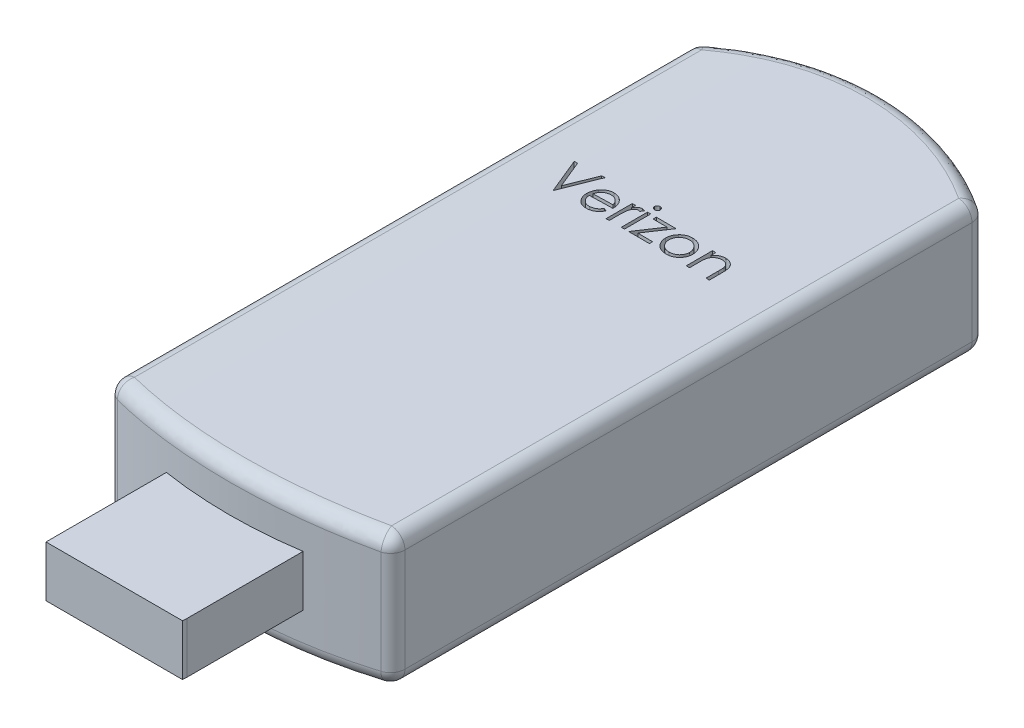
from build123d import *

# Parameters (mm, degrees)
BOSS_EXTRUDE1_DEPTH      = 6.0325
SKETCH7_W                = 0.2849358974358973
SKETCH7_H                = 2.3201923076923068
CUT_EXTRUDE3_DEPTH       = 1.5239999999999987
CUT_EXTRUDE1_DEPTH       = 60.16156349913395
CUT_EXTRUDE2_DEPTH       = 34.601982625255914
BOSS_EXTRUDE2_REACH      = 39.546
BOSS_EXTRUDE2_END_RADIUS = 49.760028750000046
BOSS_EXTRUDE3_DEPTH      = 4.4958
FILLET1_R                = 1.27


with BuildPart() as part:
    # Sketch1 → Boss-Extrude1 (new, symmetric)
    with BuildSketch(Plane(origin=(0, 0, 0), x_dir=(1, 0, 0), z_dir=(0, 1, 0))):
        Polygon((-12.522200000000005, 28.75279999999999), (12.522199999999993, 28.75279999999999), (12.522200000000002, -28.752799999999997), (-12.5222, -28.752799999999997), align=None)
    extrude(amount=BOSS_EXTRUDE1_DEPTH, both=True)

    # Sketch7 → Cut-Extrude3 (cut)
    # profile 1 of 8: a face of its own
    with BuildSketch(Plane(origin=(0, 6.0325, 0), x_dir=(1, 0, 0), z_dir=(0, 1, 0))):
        Polygon((-8.24346165754675, 9.907809330896033), (-7.9381731960082895, 9.907809330896033), (-6.879839862674955, 7.405715981537058), (-5.8215065293416215, 9.907809330896033), (-5.516218067803161, 9.907809330896033), (-6.859487298572391, 6.732809330896032), (-6.900192426777519, 6.732809330896032), align=None)
    # profile 2 of 8: a face of its own
    with BuildSketch(Plane(origin=(0, 6.0325, 0), x_dir=(1, 0, 0), z_dir=(0, 1, 0))):
        with BuildLine():
            Line((-3.123519750495468, 7.465501638588339), (-2.8703847344698272, 7.332573954293468))
            add(Edge.make_bspline(
                [(-2.8703847344698272, 7.332573954293468), (-2.890556503008947, 7.296793218065141), (-2.9298027764200434, 7.2271780747947885), (-2.9972948834352406, 7.13153631565227), (-3.068044834988314, 7.04549588771282), (-3.145246291677269, 6.9713554156124315), (-3.2265895004426985, 6.906720230671554), (-3.3125255515697076, 6.850170918247935), (-3.403501836229628, 6.801984831934233), (-3.4995226579927623, 6.76138789593536), (-3.6013943936711206, 6.7301735691374605), (-3.7093639121288033, 6.708126168730543), (-3.8236380543652744, 6.694497917883364), (-3.901966374673883, 6.692914825892747), (-3.942074437995468, 6.692104202690904)],
                knots=[0, 0, 0, 0, 1.120438280834344, 2.1799291928520534, 3.1904907245114247, 4.156257408411693, 5.0951983406147265, 6.022838206048523, 6.959905091848168, 7.9013211663531715, 8.86406683785401, 9.862729781234922, 10.90560950455938, 11.999999999999998, 11.999999999999998, 11.999999999999998, 11.999999999999998], degree=3))
            add(Edge.make_bspline(
                [(-3.942074437995468, 6.692104202690904), (-3.9866532319026193, 6.6931448545970165), (-4.073613544263185, 6.695174864987218), (-4.200196029144133, 6.712675886295626), (-4.31937593011903, 6.741225811682033), (-4.431146546732656, 6.7811088386062615), (-4.53523416157086, 6.8332036254595865), (-4.631845651293105, 6.8966668696672535), (-4.721489078331388, 6.971172557849007), (-4.801339610949346, 7.057366045869324), (-4.873225133122389, 7.149606107130151), (-4.936657841243187, 7.245723230913863), (-4.989687082266609, 7.345475584543774), (-5.032824092944165, 7.448228131354707), (-5.067662791881055, 7.5533332347831195), (-5.091944016014479, 7.661747208935196), (-5.105941001683914, 7.773176631781641), (-5.108085891564231, 7.848557786325602), (-5.109166785751879, 7.886545308460134)],
                knots=[0, 0, 0, 0, 1.1452585230262686, 2.2340675950855617, 3.2767471583466503, 4.290159414346911, 5.277019951787686, 6.260822364392955, 7.254936241552866, 8.264827045116265, 9.274100331278769, 10.257902743884044, 11.22070474718039, 12.172965370818138, 13.118907548450304, 14.06271320799012, 15.023725156007151, 16, 16, 16, 16], degree=3))
            add(Edge.make_bspline(
                [(-5.109166785751879, 7.886545308460134), (-5.108205993259124, 7.9221913331960785), (-5.106301829418917, 7.992837046876308), (-5.094299615140359, 8.09739936227164), (-5.073028663571517, 8.199025172779688), (-5.043840141131943, 8.297798922008594), (-5.0061472249514365, 8.393555229265585), (-4.96003514037672, 8.486352372695166), (-4.9054320548111825, 8.576091606711438), (-4.863274700760673, 8.632700163717816), (-4.842039381905725, 8.661214779613982)],
                knots=[0, 0, 0, 0, 1.0243584636889644, 2.0301432001959165, 3.0194274126504173, 4.004406731860269, 4.98636706593981, 5.97262665546806, 6.978780324837733, 8, 8, 8, 8], degree=3))
            add(Edge.make_bspline(
                [(-4.842039381905725, 8.661214779613982), (-4.813275983959076, 8.695567254622429), (-4.756660339535861, 8.763184005388212), (-4.660905645750574, 8.852028058061547), (-4.557219039068555, 8.92645348268645), (-4.446899921106268, 8.988145670468977), (-4.328666119637017, 9.035021050241001), (-4.204106977052922, 9.069952928408846), (-4.071804195261634, 9.089527266989036), (-3.9813573163584137, 9.092292087488984), (-3.935078244085212, 9.093706766793469)],
                knots=[0, 0, 0, 0, 1.0306820359004325, 2.0287146798918063, 2.9971460585133616, 3.9627203379023315, 4.930598197086325, 5.918074683524115, 6.934738563044366, 8, 8, 8, 8], degree=3))
            add(Edge.make_bspline(
                [(-3.935078244085212, 9.093706766793469), (-3.887500773559726, 9.092478451012413), (-3.79416462188679, 9.090068775450078), (-3.6580640549462773, 9.067729173000433), (-3.52928540494159, 9.032302927075065), (-3.407880204604309, 8.98227055997815), (-3.2938361452070968, 8.917718680854026), (-3.187894514521483, 8.837761438939165), (-3.088243499566542, 8.744853602670709), (-3.030269288750617, 8.673404119833098), (-3.000768348251878, 8.637046109742187)],
                knots=[0, 0, 0, 0, 1.0563218754078567, 2.0722627262349573, 3.0550385914001366, 4.018067549719884, 4.982017516219839, 5.957941054872016, 6.960871418734544, 8, 8, 8, 8], degree=3))
            add(Edge.make_bspline(
                [(-3.000768348251878, 8.637046109742187), (-2.980696054211262, 8.60964714662748), (-2.940685073330878, 8.555031596102632), (-2.8905680611561513, 8.465976332161299), (-2.847063852849531, 8.37280315014366), (-2.812290381071848, 8.27400595207188), (-2.7841331192721213, 8.170755332915006), (-2.7637615765578114, 8.062313167352741), (-2.7518148511300016, 7.948711747761108), (-2.7494665328210632, 7.871308372435812), (-2.7482693498544424, 7.831847792434494)],
                knots=[0, 0, 0, 0, 0.9481747201060822, 1.8900381052939734, 2.849395471927453, 3.817997239188475, 4.8123189665736215, 5.836947057344353, 6.897266129131515, 8, 8, 8, 8], degree=3))
            Line((-2.7482693498544424, 7.831847792434494), (-4.82423088831598, 7.831847792434494))
            add(Edge.make_bspline(
                [(-4.82423088831598, 7.831847792434494), (-4.822834245340964, 7.801276657010326), (-4.820087803259382, 7.741159752180239), (-4.807283351958402, 7.653193398955425), (-4.787100535748918, 7.569397581421276), (-4.758735028926854, 7.490400821916773), (-4.724384390731345, 7.415171349099332), (-4.682305919075531, 7.344267215563506), (-4.632105037990049, 7.278011379018241), (-4.5761110106913705, 7.2158111899159), (-4.51378385992264, 7.160420356570916), (-4.448213082086273, 7.110843388129824), (-4.37845963384608, 7.069291168239615), (-4.305073515247992, 7.035563696820416), (-4.228173395867205, 7.00916011010966), (-4.147735047440783, 6.99113715849015), (-4.063916756176118, 6.97906571153938), (-4.006779697446386, 6.977723443821758), (-3.9776914251749553, 6.977040100126802)],
                knots=[0, 0, 0, 0, 1.0941538416602907, 2.1516094006952207, 3.174256924543306, 4.1720556391757855, 5.149267564922385, 6.12859581567239, 7.114449969702824, 8.118368179264088, 9.11720380756841, 10.09244225010101, 11.054858984379472, 12.01512212306778, 12.976791627669245, 13.957293640751892, 14.960065497430492, 16, 16, 16, 16], degree=3))
            add(Edge.make_bspline(
                [(-3.9776914251749553, 6.977040100126802), (-3.9492514555627385, 6.977591694382566), (-3.892821100221321, 6.978686163198166), (-3.8087826082029483, 6.989328682381723), (-3.7261060369190964, 7.0065374324094165), (-3.6451335735266883, 7.030023351985313), (-3.567508591873681, 7.058668067824989), (-3.4956215571752796, 7.093232802978081), (-3.429508790143008, 7.131468644666313), (-3.3677169704540075, 7.175201707031667), (-3.3077811407703788, 7.228730562384395), (-3.2483247423798653, 7.295528680709747), (-3.184573778257467, 7.374529509484871), (-3.144668933411339, 7.433988792193412), (-3.123519750495468, 7.465501638588339)],
                knots=[0, 0, 0, 0, 0.9911071599772423, 1.966546729181966, 2.9479048755540354, 3.9327083442494657, 4.903319530923831, 5.828989031447169, 6.710028674367333, 7.563221710290545, 8.463672341184845, 9.504779593159295, 10.677557248921072, 12, 12, 12, 12], degree=3))
        make_face()
        with BuildLine():
            add(Edge.make_bspline(
                [(-3.03320524729034, 8.11678368987039), (-3.043634328135338, 8.154577868177629), (-3.0637069516249276, 8.227319495415417), (-3.1056499393727544, 8.328049446032454), (-3.1528862655757086, 8.41757347051975), (-3.20878597903714, 8.495206423363483), (-3.2721215372841677, 8.564152467282991), (-3.345278238686212, 8.624403612399465), (-3.427316513497828, 8.678303728724934), (-3.517812305398415, 8.723799210384145), (-3.613644496145856, 8.762525010796585), (-3.7139801131485837, 8.788492080083746), (-3.816358249288531, 8.806280736312713), (-3.885604351903945, 8.807937277532137), (-3.920449838636494, 8.80877086935757)],
                knots=[0, 0, 0, 0, 1.1548815021618077, 2.222775133544412, 3.2100062769292697, 4.132804581333333, 5.035138422668762, 5.962687519113333, 6.9196550260621965, 7.923214229035662, 8.94463938105154, 9.960483928637434, 10.973690539665625, 12, 12, 12, 12], degree=3))
            add(Edge.make_bspline(
                [(-3.920449838636494, 8.80877086935757), (-3.9488882578622353, 8.808215995884527), (-4.005105033788093, 8.807119127684725), (-4.087928145649054, 8.796714081790062), (-4.167466158239107, 8.779514793942), (-4.244305954857962, 8.75596086902435), (-4.317440599738414, 8.724565922468274), (-4.388374425193955, 8.687751138329663), (-4.455303784644605, 8.642809844451712), (-4.497160531255919, 8.6085571689968), (-4.518306409149315, 8.591252840511416)],
                knots=[0, 0, 0, 0, 1.0487358100554192, 2.073130210625136, 3.073294107867221, 4.047935619982199, 5.032784715118843, 6.00535298738967, 6.992311500921003, 7.999999999999999, 7.999999999999999, 7.999999999999999, 7.999999999999999], degree=3))
            add(Edge.make_bspline(
                [(-4.518306409149315, 8.591252840511416), (-4.533449600645563, 8.577560139909231), (-4.564095729551886, 8.549849451060439), (-4.605044631188604, 8.502107242260577), (-4.64425177426822, 8.450625468013591), (-4.679933016408123, 8.393434533556706), (-4.712660541268031, 8.331185684029293), (-4.743285663425043, 8.264403972066287), (-4.770850480099081, 8.192582632471833), (-4.786359094200877, 8.142533348314746), (-4.79433805979034, 8.11678368987039)],
                knots=[0, 0, 0, 0, 0.8798707608949656, 1.780643978911088, 2.7079989676995635, 3.6696685238210653, 4.684282771663967, 5.740141943567125, 6.837334558008167, 8, 8, 8, 8], degree=3))
            Line((-4.79433805979034, 8.11678368987039), (-3.03320524729034, 8.11678368987039))
        make_face(mode=Mode.SUBTRACT)
    # profile 3 of 8: a face of its own
    with BuildSketch(Plane(origin=(0, 6.0325, 0), x_dir=(1, 0, 0), z_dir=(0, 1, 0))):
        with BuildLine():
            Line((-2.2598078113929043, 9.05300163858834), (-1.9748719139570068, 9.05300163858834))
            Line((-1.9748719139570068, 9.05300163858834), (-1.9748719139570068, 8.711460172242187))
            add(Edge.make_bspline(
                [(-1.9748719139570068, 8.711460172242187), (-1.9538363970897543, 8.743260816509245), (-1.9136061345240443, 8.80407930158361), (-1.8467379771817112, 8.88451502462621), (-1.778245669522016, 8.951112959766563), (-1.7078013210404221, 9.004184008936393), (-1.6348869018362158, 9.043928766726587), (-1.5611026670634685, 9.073041734219485), (-1.4852877765499093, 9.090256870184776), (-1.4343408881431867, 9.092555260810324), (-1.4088162248544427, 9.093706766793469)],
                knots=[0, 0, 0, 0, 1.2804752998839455, 2.448899061921011, 3.506932113041637, 4.48433164204174, 5.4025377996216175, 6.2889090754254156, 7.142734304840704, 8, 8, 8, 8], degree=3))
            add(Edge.make_bspline(
                [(-1.4088162248544427, 9.093706766793469), (-1.3890166286843737, 9.092626789096649), (-1.3482776728192636, 9.09040466479936), (-1.2866077520682693, 9.074791988159964), (-1.2230683349788418, 9.049865496272604), (-1.1821177408301322, 9.026424722855076), (-1.1607693498544422, 9.014204563267826)],
                knots=[0, 0, 0, 0, 0.9011101914680424, 1.8540927807059169, 2.88129422130767, 4, 4, 4, 4], degree=3))
            Line((-1.1607693498544422, 9.014204563267826), (-1.317229686392904, 8.767429723524238))
            add(Edge.make_bspline(
                [(-1.317229686392904, 8.767429723524238), (-1.3309357270019824, 8.773544107785831), (-1.3569524158935595, 8.78515037962134), (-1.3950112010087838, 8.798886345955403), (-1.4301006993289325, 8.806974355331912), (-1.4524559272723954, 8.808199649020613), (-1.4628777232518781, 8.80877086935757)],
                knots=[0, 0, 0, 0, 1.1805552054775093, 2.2409197795529536, 3.1799334269636095, 4, 4, 4, 4], degree=3))
            add(Edge.make_bspline(
                [(-1.4628777232518781, 8.80877086935757), (-1.4857429243654445, 8.80724683545894), (-1.5323813066906078, 8.804138248078152), (-1.6008565311551608, 8.779700901032388), (-1.6673022104313733, 8.740217290358308), (-1.7200722184076118, 8.69642849603645), (-1.7609319763726308, 8.654202994050904), (-1.7900877523898266, 8.617329086007992), (-1.8168328156978055, 8.575982755978627), (-1.8423872299182575, 8.530870828528457), (-1.8656702253794115, 8.481223039627773), (-1.8874005324427985, 8.427535410309337), (-1.907048215236669, 8.36974575778246), (-1.9182516510686594, 8.329484471582647), (-1.9239905037005964, 8.30886101358834)],
                knots=[0, 0, 0, 0, 1.1256783522279976, 2.2960575376360737, 3.5422873995020447, 4.923748040679578, 5.663163012615323, 6.437101912157194, 7.237424739643565, 8.089412069887159, 8.991984278710643, 9.939400610058751, 10.944477711153127, 12, 12, 12, 12], degree=3))
            add(Edge.make_bspline(
                [(-1.9239905037005964, 8.30886101358834), (-1.9282834605389187, 8.290466720413265), (-1.9377920337193397, 8.249724758789991), (-1.9470372144774837, 8.181372882792386), (-1.9561717057847783, 8.1006157066279), (-1.9626093524315216, 8.00722844022639), (-1.9685765763612713, 7.901444294662987), (-1.9719421509530344, 7.783102115418716), (-1.9747571427438018, 7.652080432597), (-1.974832496262405, 7.560482269307773), (-1.9748719139570068, 7.5125669430755195)],
                knots=[0, 0, 0, 0, 0.5668389480122498, 1.2555051964588233, 2.0688031596806793, 3.007127436713625, 4.06532934159123, 5.249902468625793, 6.56141416318328, 8, 8, 8, 8], degree=3))
            Line((-1.9748719139570068, 7.5125669430755195), (-1.9748719139570068, 6.732809330896032))
            Line((-1.9748719139570068, 6.732809330896032), (-2.2598078113929043, 6.732809330896032))
            Line((-2.2598078113929043, 6.732809330896032), (-2.2598078113929043, 9.05300163858834))
        make_face()
    # profile 4 of 8: a face of its own
    with BuildSketch(Plane(origin=(0, 6.0325, 0), x_dir=(1, 0, 0), z_dir=(0, 1, 0))):
        with BuildLine():
            add(Edge.make_bspline(
                [(-0.7753426671621346, 10.029924715511417), (-0.7576612592686096, 10.029104520123857), (-0.7230376666972204, 10.027498420027147), (-0.6729694881623146, 10.013744794391544), (-0.6273791986368373, 9.990431508309747), (-0.5869408266581755, 9.959153512064216), (-0.5522409008832999, 9.92236937406905), (-0.5279469707570341, 9.879496924258364), (-0.5123328685667512, 9.83317944478561), (-0.5104473219935423, 9.800871471028486), (-0.5094872985723902, 9.784421911024237)],
                knots=[0, 0, 0, 0, 1.0551941146486337, 2.0662727385357784, 3.0747289982328403, 4.095836921005721, 5.109056067369165, 6.073838105316671, 7.01929734428161, 8, 8, 8, 8], degree=3))
            add(Edge.make_bspline(
                [(-0.5094872985723902, 9.784421911024237), (-0.5104689721277872, 9.76839936136904), (-0.5124096245705223, 9.736724676891438), (-0.527934910341394, 9.691210170101035), (-0.5524479403842485, 9.648933427226838), (-0.5869185757736637, 9.61222071153429), (-0.627385094682527, 9.580960006257184), (-0.6729679218465431, 9.557642135964766), (-0.7230380787132991, 9.54388972564015), (-0.7576613985483014, 9.542283457998481), (-0.7753426671621346, 9.541463177049879)],
                knots=[0, 0, 0, 0, 0.9612970799407157, 1.900370562215021, 2.8599764074188605, 3.87933697972215, 4.906634144680994, 5.921202961029529, 6.938410036506095, 8, 8, 8, 8], degree=3))
            add(Edge.make_bspline(
                [(-0.7753426671621346, 9.541463177049879), (-0.7928217453490983, 9.54225213753669), (-0.8268424873528449, 9.543787746044528), (-0.8761609800490207, 9.557911976419623), (-0.9213625382843866, 9.580967985589366), (-0.9618797770530062, 9.612016024925738), (-0.9956528808228672, 9.649158895984083), (-1.0202349331468972, 9.691184369697329), (-1.0357243628574238, 9.736731245672214), (-1.037669847386458, 9.76840156796693), (-1.0386539652390576, 9.784421911024237)],
                knots=[0, 0, 0, 0, 1.0549340136186576, 2.053291227626915, 3.073705703540028, 4.106921865220684, 5.12354521460313, 6.088680038223072, 7.0331641972253, 8, 8, 8, 8], degree=3))
            add(Edge.make_bspline(
                [(-1.0386539652390576, 9.784421911024237), (-1.0376914080937774, 9.80086918173528), (-1.0358008851265117, 9.833172659176105), (-1.0202233226294888, 9.879523153321045), (-0.9958576398740643, 9.922142087099623), (-0.9618574143829588, 9.959358075864595), (-0.9213684897090887, 9.990423577405123), (-0.876159442308012, 10.013474967767808), (-0.8268428935860049, 10.027600397053696), (-0.7928218832249421, 10.029135840057029), (-0.7753426671621346, 10.029924715511417)],
                knots=[0, 0, 0, 0, 0.9863189498223914, 1.9371926506717805, 2.907499808429839, 3.917963146730997, 4.944918756744033, 5.959150250057987, 6.951458132713477, 8, 8, 8, 8], degree=3))
        make_face()
    # profile 5 of 8: a face of its own
    with BuildSketch(Plane(origin=(0, 6.0325, 0), x_dir=(1, 0, 0), z_dir=(0, 1, 0))):
        with Locations((-0.7740706319057243, 7.892905484742187)):
            Rectangle(SKETCH7_W, SKETCH7_H)
    # profile 6 of 8: a face of its own
    with BuildSketch(Plane(origin=(0, 6.0325, 0), x_dir=(1, 0, 0), z_dir=(0, 1, 0))):
        Polygon((-0.14314114472623735, 9.05300163858834), (1.6071793680942759, 9.05300163858834), (0.2575499610429927, 7.017745228331929), (1.5664742398891467, 7.017745228331929), (1.5664742398891467, 6.732809330896032), (-0.26525652934162103, 6.732809330896032), (1.0850088953378647, 8.768065741152444), (-0.14314114472623735, 8.768065741152444), align=None)
    # profile 7 of 8: a face of its own
    with BuildSketch(Plane(origin=(0, 6.0325, 0), x_dir=(1, 0, 0), z_dir=(0, 1, 0))):
        with BuildLine():
            add(Edge.make_bspline(
                [(3.0534834546327367, 9.093706766793469), (3.0970183949976913, 9.092779765546092), (3.182379773650226, 9.090962142647673), (3.3073912129836254, 9.07153570951994), (3.4267214434401363, 9.04182917182727), (3.540827489188474, 9.000761397659728), (3.6482479857777537, 8.94571419966383), (3.7505476143614067, 8.88002862842862), (3.8474459009927258, 8.802211561409564), (3.90552393467604, 8.742015313669624), (3.9350038873250446, 8.711460172242187)],
                knots=[0, 0, 0, 0, 1.0540114184192344, 2.0666588041132705, 3.0570718087403663, 4.030435132800687, 4.997543892327468, 5.9749647178206295, 6.972108033878539, 8, 8, 8, 8], degree=3))
            add(Edge.make_bspline(
                [(3.9350038873250446, 8.711460172242187), (3.9603875170839635, 8.6822374851332), (4.010663533442741, 8.624357650409303), (4.075130292630236, 8.530508630079137), (4.130666993630196, 8.433317253113849), (4.1751741082395535, 8.331492892490628), (4.210266951153996, 8.225924440801313), (4.2351822613284495, 8.11624904496442), (4.250002195167255, 8.002708915751755), (4.252000600892885, 7.925598291210447), (4.253012701427609, 7.886545308460134)],
                knots=[0, 0, 0, 0, 1.0252582367454968, 2.0306749023738884, 3.0120449801776643, 3.9882694853432787, 4.970941829859707, 5.9565179592348665, 6.965070386042261, 8, 8, 8, 8], degree=3))
            add(Edge.make_bspline(
                [(4.253012701427609, 7.886545308460134), (4.252122488289228, 7.847265970423932), (4.25036338561161, 7.769648166624559), (4.233723105028287, 7.655330599087869), (4.207841334268199, 7.544482438508984), (4.170801023920066, 7.437567766319146), (4.123304739088138, 7.334259772881686), (4.065346758254107, 7.235009681741026), (3.9965203626950543, 7.139621675128988), (3.9185024513499305, 7.048905721857159), (3.8322768208411717, 6.96529779843738), (3.738735743437446, 6.8924285824854366), (3.6397174413919706, 6.829997628236946), (3.533905256635652, 6.779708879786414), (3.4222654650097097, 6.74005793736095), (3.3045572675144013, 6.7122086367419485), (3.180963525158828, 6.695370537887671), (3.0965745457766425, 6.693208296429553), (3.0534834546327367, 6.692104202690904)],
                knots=[0, 0, 0, 0, 0.9986564185410766, 1.973391656597275, 2.9322422376494726, 3.8907590891153445, 4.846373662715924, 5.820377560062559, 6.809684879238112, 7.834544680162945, 8.860553228673854, 9.859544524977167, 10.845671540933473, 11.832270359807001, 12.833544569221942, 13.853853460447532, 14.904124723144172, 16, 16, 16, 16], degree=3))
            add(Edge.make_bspline(
                [(3.0534834546327367, 6.692104202690904), (3.0101812447924767, 6.693212002116954), (2.925371679185839, 6.695381683259073), (2.801341681298313, 6.71214321830661), (2.6834225269788265, 6.740045102494629), (2.5716365840362236, 6.7798391851854145), (2.4653694728698103, 6.829999235586684), (2.365777436351443, 6.892239839704022), (2.2721603701334803, 6.965319409098891), (2.1859164985562067, 7.048899866279829), (2.107903478010401, 7.139623183805683), (2.0390758204346504, 7.23500929015338), (1.981118167427113, 7.334259874914287), (1.9336217967626235, 7.4375677391105475), (1.8965815093297684, 7.544482445804748), (1.8706997324092163, 7.655330597107599), (1.8540594534815684, 7.769648167137299), (1.8523003505778481, 7.84726597059622), (1.851410137325045, 7.886545308460134)],
                knots=[0, 0, 0, 0, 1.099876185687825, 2.154163075588425, 3.173186993074358, 4.173200200966735, 5.163417410544394, 6.152872553721898, 7.150605723596097, 8.175322120237265, 9.198891216021371, 10.186952604737495, 11.159729844704987, 12.114140920381677, 13.071450618804228, 14.029093626515142, 15.002601286144056, 15.999999999999998, 15.999999999999998, 15.999999999999998, 15.999999999999998], degree=3))
            add(Edge.make_bspline(
                [(1.851410137325045, 7.886545308460134), (1.8524291402887045, 7.925386032234421), (1.8544465910307373, 8.002283990134462), (1.8692516242624306, 8.115610680867999), (1.8940697433590612, 8.225100455233726), (1.9292046529999898, 8.330261422733217), (1.9741220047371772, 8.43163956828349), (2.0288783159436874, 8.52907109353537), (2.0940026754625745, 8.622495741112541), (2.1440787314954752, 8.680300770852284), (2.16941895142761, 8.709552119357571)],
                knots=[0, 0, 0, 0, 1.0313530544956837, 2.0419017993992563, 3.0294287678284113, 4.008703097481055, 4.981709435438215, 5.96992635950705, 6.972712377853356, 8, 8, 8, 8], degree=3))
            add(Edge.make_bspline(
                [(2.16941895142761, 8.709552119357571), (2.1988544590012173, 8.740372242823266), (2.256744564065022, 8.800985438673445), (2.3541251956470326, 8.878575656952323), (2.4561731619401015, 8.945628095383213), (2.5647807735077035, 8.999581519401007), (2.678793080367583, 9.042070746195671), (2.798734821803591, 9.071612320621298), (2.924170467970426, 9.090892149771738), (3.0099495528214186, 9.092759211066676), (3.0534834546327367, 9.093706766793469)],
                knots=[0, 0, 0, 0, 1.0279801691000952, 2.0217038841236077, 2.998553060536361, 3.9714914109818293, 4.943284453966808, 5.930300938474325, 6.949603205956863, 8, 8, 8, 8], degree=3))
        make_face()
        with BuildLine():
            add(Edge.make_bspline(
                [(3.0522114193763263, 8.80877086935757), (3.0214251576773137, 8.807895846910197), (2.9606473766714823, 8.806168390579138), (2.8711853248292063, 8.79302941987769), (2.7850610423334516, 8.772212755472726), (2.7021111337284727, 8.742636218722694), (2.6226153273221673, 8.704446503281776), (2.546497512285052, 8.657539633670572), (2.4735337989399557, 8.60253688029319), (2.40515149860529, 8.539524313904082), (2.342393258286613, 8.470691226000353), (2.287531093803068, 8.397350214726119), (2.2408811758808307, 8.320690886318147), (2.20201903170142, 8.240633523355466), (2.1730746539290204, 8.156366833600892), (2.1520534121033674, 8.068845118130675), (2.1389268368263084, 7.977890061750519), (2.1372156219645233, 7.916058280859084), (2.136346034760943, 7.884637255575519)],
                knots=[0, 0, 0, 0, 1.021534395756589, 2.0166980454534906, 2.9946457235130746, 3.9583886323402013, 4.9340804896666075, 5.916473866624788, 6.921342794990959, 7.9622525759241, 8.998418191392973, 10.008913653328644, 10.997312073922775, 11.973003931249183, 12.956656625961829, 13.948281151566837, 14.957379055205045, 16, 16, 16, 16], degree=3))
            add(Edge.make_bspline(
                [(2.136346034760943, 7.884637255575519), (2.1378036533445943, 7.844040773794773), (2.140696753666105, 7.7634643487893555), (2.1642237181464705, 7.644799973254761), (2.2035812720397687, 7.530879293118484), (2.2567283043474, 7.422370142922833), (2.3233182312933507, 7.321974576416306), (2.401774356064014, 7.232465444181068), (2.4912546556789485, 7.155189743796589), (2.590692480855272, 7.091072119610773), (2.6980567549609065, 7.040127198373091), (2.8116821319665593, 7.004023841830109), (2.930191904422311, 6.980554520869748), (3.0111822819648806, 6.978221826276411), (3.0522114193763263, 6.977040100126802)],
                knots=[0, 0, 0, 0, 1.0167929363761827, 2.0181438437557535, 3.017858371347361, 4.0300880566738835, 5.038013929809556, 6.028138511856119, 7.0037882367892745, 7.991172063315284, 8.984598303172705, 9.972568033648367, 10.972917681534744, 12, 12, 12, 12], degree=3))
            add(Edge.make_bspline(
                [(3.0522114193763263, 6.977040100126802), (3.0932381969086173, 6.978228711512006), (3.174223916115287, 6.980574997369146), (3.292569026528912, 7.003905640978999), (3.4058838438668806, 7.040285390332287), (3.5131366025428825, 7.091014823577401), (3.612529164229318, 7.1554332284042275), (3.7026530100009007, 7.232029084749475), (3.780439250101068, 7.322211649904909), (3.846963305982029, 7.4225031224778135), (3.9009807082975168, 7.530711070447939), (3.940154041351193, 7.644820998898189), (3.9637375656868454, 7.763458994064477), (3.9666230317462654, 7.844038979804709), (3.968076803991711, 7.884637255575519)],
                knots=[0, 0, 0, 0, 1.0272683396823263, 2.0277991670668185, 3.0108909879574934, 4.004497153371875, 4.992059811076067, 5.971914810892564, 6.958719427703591, 7.966827852514281, 8.981595045699109, 9.981490637758275, 10.983022905980247, 12, 12, 12, 12], degree=3))
            add(Edge.make_bspline(
                [(3.968076803991711, 7.884637255575519), (3.9672075161824436, 7.916058468642224), (3.965496890482958, 7.977890619062218), (3.952366029938208, 8.068842987679128), (3.9313606475292535, 8.15637465033593), (3.9023578233059384, 8.240604681885241), (3.863664539314776, 8.320898167948615), (3.816115019880018, 8.397125134636125), (3.7614768754036962, 8.47094528712648), (3.697961344303292, 8.539301804126762), (3.629650422938959, 8.60256144444673), (3.5566571383021874, 8.657560961973408), (3.480652193444631, 8.704240352172862), (3.4013873363163816, 8.742962870406442), (3.3184267928076476, 8.771943671987815), (3.23242318276503, 8.79314961627998), (3.1433428337483282, 8.806112866082616), (3.082782844595868, 8.8078792015511), (3.0522114193763263, 8.80877086935757)],
                knots=[0, 0, 0, 0, 1.0429567357771468, 2.0523796338228486, 3.04432352628412, 4.028293020410925, 5.004299113249982, 5.996692470556599, 7.007513377003379, 8.048758397813936, 9.09000341862448, 10.095195979396193, 11.077905750187236, 12.047570684004176, 13.018257070683953, 13.989683339069021, 14.985167495447726, 16, 16, 16, 16], degree=3))
        make_face(mode=Mode.SUBTRACT)
    # profile 8 of 8: a face of its own
    with BuildSketch(Plane(origin=(0, 6.0325, 0), x_dir=(1, 0, 0), z_dir=(0, 1, 0))):
        with BuildLine():
            Line((4.8228844962994035, 9.05300163858834), (5.107820393735302, 9.05300163858834))
            Line((5.107820393735302, 9.05300163858834), (5.107820393735302, 8.634502039229366))
            add(Edge.make_bspline(
                [(5.107820393735302, 8.634502039229366), (5.138243819890863, 8.672459366374925), (5.1972815397688175, 8.746116883969336), (5.2956016135258, 8.842927690891699), (5.399509294532741, 8.922706573610892), (5.508368254838951, 8.986300729546096), (5.622326271143884, 9.034240168980954), (5.740688701753263, 9.068862120751533), (5.864164185132914, 9.089621929498184), (5.9481333528681954, 9.092334495555612), (5.990612861684019, 9.093706766793469)],
                knots=[0, 0, 0, 0, 1.1278077301501719, 2.188550247705353, 3.191906510434036, 4.159438251139453, 5.10488017219796, 6.052711205924762, 7.0148780352848625, 8, 8, 8, 8], degree=3))
            add(Edge.make_bspline(
                [(5.990612861684019, 9.093706766793469), (6.033548508346889, 9.09212362521467), (6.11758392553263, 9.089025035269513), (6.239937595500639, 9.064517036904492), (6.354213459773647, 9.022656698327129), (6.460004056809985, 8.965314320175796), (6.555369457503238, 8.894007019302343), (6.639121287056621, 8.810932888706539), (6.7083936614634245, 8.715378013199949), (6.754836983613166, 8.626729150042463), (6.78543096401856, 8.54809002952357), (6.804691727334672, 8.480737620505328), (6.821048403372815, 8.405700440516236), (6.835228631931727, 8.323205241874037), (6.844823583411472, 8.232674026430823), (6.852391233586278, 8.134477905782816), (6.85781476340495, 8.028648687404681), (6.858029944028642, 7.95545438968286), (6.858140906555813, 7.917710172242185)],
                knots=[0, 0, 0, 0, 1.2358467778636726, 2.4188502474621263, 3.5758077408064, 4.7286823071819235, 5.871620073916638, 6.99408840778219, 8.112697850292317, 9.256955736378842, 9.86581671514486, 10.540099791640456, 11.271859617830463, 12.076849838482394, 12.949306005097043, 13.892391287565133, 14.913166134548694, 16, 16, 16, 16], degree=3))
            Line((6.858140906555813, 7.917710172242185), (6.858140906555813, 6.732809330896032))
            Line((6.858140906555813, 6.732809330896032), (6.573205009119917, 6.732809330896032))
            Line((6.573205009119917, 6.732809330896032), (6.573205009119917, 7.824215580896031))
            add(Edge.make_bspline(
                [(6.573205009119917, 7.824215580896031), (6.573029741845587, 7.855804513081405), (6.5726944853782445, 7.916228764283505), (6.571637077314415, 8.002742092463313), (6.56908818132458, 8.081197774300119), (6.565506497465028, 8.15140824330361), (6.560264091199205, 8.213306080757507), (6.5548007041888505, 8.267017353227434), (6.54811961809448, 8.31247386672006), (6.542166118320053, 8.339837905739042), (6.539496074825045, 8.352110212306288)],
                knots=[0, 0, 0, 0, 1.4308001552892853, 2.7368771915384023, 3.918605306947138, 4.986035425796519, 5.920637408686353, 6.731861384559874, 7.431261377472525, 8, 8, 8, 8], degree=3))
            add(Edge.make_bspline(
                [(6.539496074825045, 8.352110212306288), (6.529857199815738, 8.388133930080228), (6.511305347632261, 8.457468441275374), (6.465463805797307, 8.551515889724827), (6.407575227511624, 8.631524245827123), (6.336910749873221, 8.696998843300682), (6.254152945542312, 8.747953816597361), (6.159531466031491, 8.783308761242624), (6.053959413421603, 8.805421519730206), (5.979705794853513, 8.807623275201253), (5.94100348668402, 8.80877086935757)],
                knots=[0, 0, 0, 0, 1.0841562269648441, 2.0866653055494226, 3.0278082329960276, 3.945421171797412, 4.874247719431522, 5.839848302853166, 6.874090471440527, 8, 8, 8, 8], degree=3))
            add(Edge.make_bspline(
                [(5.94100348668402, 8.80877086935757), (5.918082087985317, 8.808339065127074), (5.872721232190861, 8.80748453571164), (5.805456614818854, 8.798910858219353), (5.740211114864564, 8.784887830640841), (5.676329925276443, 8.765956995195186), (5.615090712388226, 8.73995622240032), (5.554525962531917, 8.71044743655344), (5.496916255071287, 8.673664415681033), (5.441033173390452, 8.63267006623211), (5.389042269305078, 8.587241071131437), (5.340665848032553, 8.539303551207032), (5.297542072519055, 8.48825353919201), (5.258472631368847, 8.434913586790637), (5.224746635304907, 8.378551133750411), (5.195307048276952, 8.31970994144464), (5.1703282394301615, 8.25831256358299), (5.157916082689657, 8.215699472323662), (5.151705610081455, 8.194377840511416)],
                knots=[0, 0, 0, 0, 1.0237777570634758, 2.0260297294316247, 3.0237499517037842, 4.0036831033663836, 4.99761860739714, 5.9931778953270225, 7.0103604940512545, 8.04672660171793, 9.087585522244352, 10.092341339987046, 11.086953742807356, 12.070360548997257, 13.043493632276725, 14.01787080769746, 15.008233676703245, 16, 16, 16, 16], degree=3))
            add(Edge.make_bspline(
                [(5.151705610081455, 8.194377840511416), (5.148131786016364, 8.178724906312526), (5.140351757978208, 8.1446492873876), (5.131948730534815, 8.088728992660158), (5.124321858563297, 8.02404065820299), (5.117938331816447, 7.95065977058805), (5.114032704018135, 7.868329412445706), (5.109774215516322, 7.777401188152085), (5.108223852977528, 7.6775125237147845), (5.107958646118756, 7.60796941674303), (5.107820393735302, 7.571716582498596)],
                knots=[0, 0, 0, 0, 0.6159636377364576, 1.3409206174653763, 2.1684191490738827, 3.115676020576589, 4.166742419724601, 5.331190068864589, 6.608748900122521, 8, 8, 8, 8], degree=3))
            Line((5.107820393735302, 7.571716582498596), (5.107820393735302, 6.732809330896032))
            Line((5.107820393735302, 6.732809330896032), (4.8228844962994035, 6.732809330896032))
            Line((4.8228844962994035, 6.732809330896032), (4.8228844962994035, 9.05300163858834))
        make_face()
    extrude(amount=-CUT_EXTRUDE3_DEPTH, mode=Mode.SUBTRACT)

    # Sketch2 → Cut-Extrude1 (cut, through all)
    with BuildSketch(Plane.XY.offset(28.752799999999997)):
        with BuildLine():
            Line((-12.5222, 6.0325), (-12.5222, 5.5245))
            ThreePointArc((-12.522200000000002, 5.524499999999989), (-6.266250011785668, 5.9054477901150335), (-3.256329e-11, 6.032499999999999))
            Line((-3.25624e-11, 6.0325), (-12.5222, 6.0325))
        make_face()
        with BuildLine():
            Line((12.522200000000003, 6.0325), (-3.25624e-11, 6.0325))
            ThreePointArc((-3.256329e-11, 6.032499999999999), (6.266250011753132, 5.905447790116341), (12.522200000000005, 5.524499999999989))
            Line((12.522200000000002, 5.5245), (12.522200000000002, 6.0325))
        make_face()
    extrude(amount=-CUT_EXTRUDE1_DEPTH, mode=Mode.SUBTRACT)

    # Sketch4 → Cut-Extrude2 (cut, through all)
    with BuildSketch(Plane.XZ.offset(6.0325)):
        with BuildLine():
            Line((-12.5222, 28.752799999999997), (-12.522200000000005, 26.7208))
            ThreePointArc((-12.522200000000005, 26.7208), (-6.342998551030786, 28.24149911856139), (-2.2494108265e-07, 28.752799999999997))
            Line((-2.2494108265e-07, 28.752799999999997), (-12.5222, 28.752799999999997))
        make_face()
        with BuildLine():
            Line((12.522200000000003, 28.752799999999997), (-2.2494108265e-07, 28.752799999999997))
            ThreePointArc((-2.2494108265e-07, 28.752799999999997), (6.34299832899406, 28.24149915459169), (12.522200000000002, 26.7208))
            Line((12.522200000000002, 26.7208), (12.522200000000002, 28.752799999999997))
        make_face()
        with BuildLine():
            ThreePointArc((1.6949208792e-07, -28.752799999999993), (-6.544493651062177, -27.779220757630085), (-12.522200000000007, -24.942799999999995))
            Line((-12.522200000000005, -24.94279999999999), (-12.522200000000005, -28.75279999999999))
            Line((-12.522200000000005, -28.75279999999999), (1.6949208792e-07, -28.75279999999999))
        make_face()
        with BuildLine():
            ThreePointArc((12.522200000000003, -24.942799999999995), (6.544493813214811, -27.779220708293586), (1.6949208792e-07, -28.752799999999993))
            Line((1.6949208792e-07, -28.75279999999999), (12.522199999999991, -28.75279999999999))
            Line((12.522199999999993, -28.75279999999999), (12.522200000000002, -24.94279999999999))
        make_face()
    extrude(amount=-CUT_EXTRUDE2_DEPTH, mode=Mode.SUBTRACT)

    # Boss-Extrude2: up to this cylinder (the profile starts inside it)
    boss_extrude2_end = Plane(origin=(-2.6e-15, 0, -10.847228750000045), z_dir=(0, -1, 0)) * Cylinder(BOSS_EXTRUDE2_END_RADIUS, 179.6120575000001, mode=Mode.PRIVATE)
    # Sketch5 → Boss-Extrude2 (add, up to the surface)
    with BuildSketch(Plane.XY, mode=Mode.PRIVATE) as boss_extrude2_sk1:
        Polygon((-6.032499999999999, 2.247899999999999), (6.032500000000001, 2.247899999999999), (6.0325000000000015, -2.2479), (-6.032499999999998, -2.2479), align=None)
    boss_extrude2_tool1 = extrude(boss_extrude2_sk1.sketch, amount=BOSS_EXTRUDE2_REACH, mode=Mode.PRIVATE) & boss_extrude2_end
    add(boss_extrude2_tool1.solids().sort_by_distance((0, 0, 0))[0])

    # Sketch6 → Boss-Extrude3 (add)
    with BuildSketch(Plane(origin=(0, 2.247899999999999, 0), x_dir=(1, 0, 0), z_dir=(0, 1, 0))):
        Polygon((-6.0325, -38.545780926985934), (-6.0325, -38.91280000000001), (6.017249122015336, -38.9128), (6.032500000000001, -38.545780926985934), align=None)
    extrude(amount=-BOSS_EXTRUDE3_DEPTH)

    # Fillet1
    fillet1_edges = [part.edges().sort_by_distance(p)[0] for p in [
        (-1.299e-14, 6.032500000000027, 28.752799999999997),
        (-12.522200000000005, -0.2540000000000022, 26.7208),
        (-5.33e-15, -6.0325, 28.752800000000004),
        (12.522199999999998, -6.0325, 0.8890000000000029),
        (12.522200000000002, -0.2540000000000022, 26.7208),
        (-12.522200000000002, 5.524499999999994, 0.8890000000000029),
        (5.6648e-12, 6.032499999999999, -28.752799999999997),
        (-12.522200000000002, -6.0325, 0.8890000000000029),
        (-12.522200000000007, -0.2540000000000022, -24.942799999999995),
        (1.11e-15, -6.0325, -28.752799999999997),
        (12.522200000000003, 5.524499999999994, 0.8890000000000065),
        (12.522200000000002, -0.2540000000000022, -24.94279999999999),
    ]]
    fillet(fillet1_edges, radius=FILLET1_R)


solid = part.part
